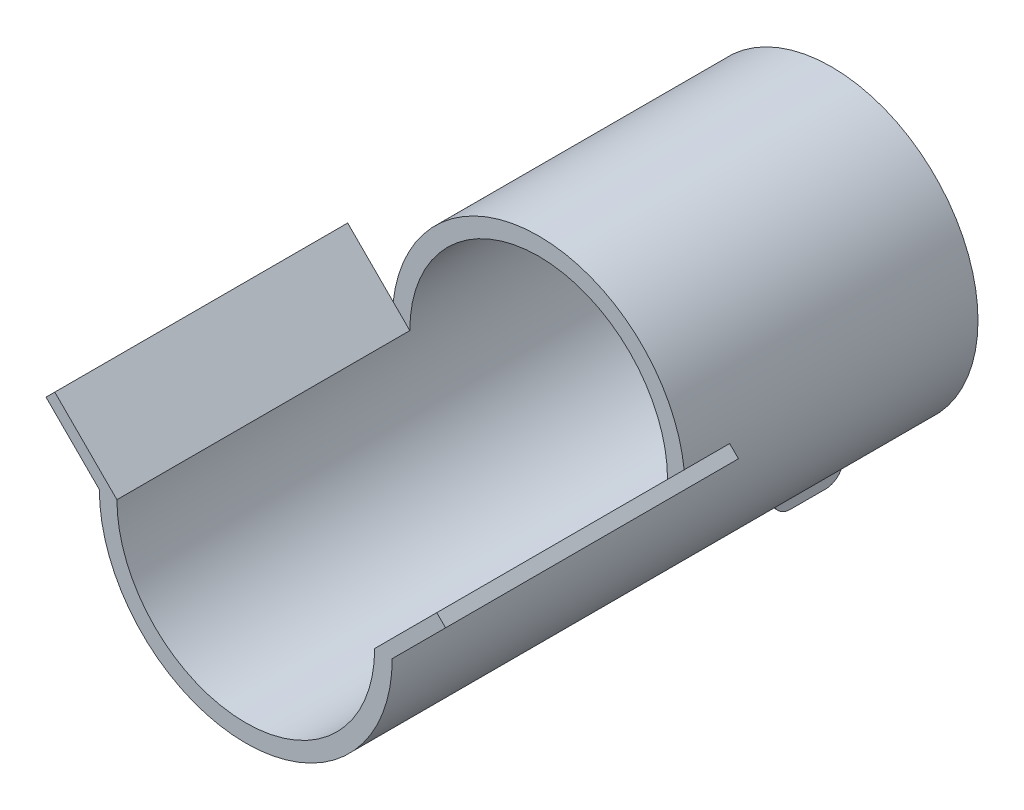
from build123d import *

# Parameters (mm, degrees)
SKETCH1_R           = 25
SKETCH1_R_2         = 22
BOSS_EXTRUDE1_DEPTH = 100
SKETCH2_W           = 10
SKETCH2_H           = 10
BOSS_EXTRUDE3_DEPTH = 3
FILLET2_R           = 3
FILLET3_R           = 3
SKETCH3_W           = 4
SKETCH3_H           = 10
BOSS_EXTRUDE4_DEPTH = 12
CUT_EXTRUDE1_REACH  = 111.309
SKETCH4_R           = 1.5
FILLET4_R           = 3
SKETCH5_W           = 63.273881994
SKETCH5_H           = 26.217893921
CUT_EXTRUDE2_DEPTH  = 50
BOSS_EXTRUDE5_DEPTH = 50


with BuildPart() as part:
    # Sketch1 → Boss-Extrude1 (new body)
    with BuildSketch(Plane.XY):
        Circle(SKETCH1_R)
        Circle(SKETCH1_R_2, mode=Mode.SUBTRACT)
    extrude(amount=BOSS_EXTRUDE1_DEPTH)

    # Sketch2 → Boss-Extrude3 (add)
    with BuildSketch(Plane(origin=(0, 0, 0), x_dir=(-1, 0, 0), z_dir=(0, 0, -1))):
        with Locations((0, 19.494897428)):
            Rectangle(SKETCH2_W, SKETCH2_H)
    extrude(amount=-BOSS_EXTRUDE3_DEPTH)

    # Fillet2
    # the kernel refuses this fillet: 3 mm, written as the material it adds along each edge
    with BuildSketch(Plane(origin=(0, 0, 3), x_dir=(-0.5397978604012739, 0.8417946720585768, 0), z_dir=(-0.8417946720585768, -0.5397978604012739, 0))) as fillet2_piece_1_section:
        with BuildLine():
            CenterArc((22 - FILLET2_R, -FILLET2_R), FILLET2_R, 0, 90)
            Line((22 - FILLET2_R, 0), (22, 0))
            Line((22, 0), (22, -FILLET2_R))
        make_face()
    fillet2_piece_1 = revolve(axis=Axis((0, 0, 3), (0, 0, -1)), revolution_arc=65.339758778, mode=Mode.PRIVATE)
    fillet2_piece_1 = split(fillet2_piece_1, bisect_by=Plane(origin=(5, 21.121644808, 3.678956026), z_dir=(-1, 0, 0)), keep=Keep.TOP, mode=Mode.PRIVATE)
    fillet2_piece_1 = split(fillet2_piece_1, bisect_by=Plane(origin=(-5, 21.121644808, 3.678956026), z_dir=(1, 0, 0)), keep=Keep.TOP, mode=Mode.PRIVATE)
    add(fillet2_piece_1)
    with BuildSketch(Plane(origin=(5, 21.424285286, 3), x_dir=(0.9454116384931546, -0.32587855683013084, 0), z_dir=(0, 0, -1))) as fillet2_piece_2:
        with BuildLine():
            CenterArc((4.201860731, 2.984203833), FILLET2_R, 160.981189421, 114.90106237)
            Line((1.365625815, 3.961839503), (0, 0))
            ThreePointArc((0, 0), (2.254656978, -0.11583856), (4.509313955, 0))
        make_face()
    extrude(amount=3)
    with BuildSketch(Plane(origin=(-5, 21.424285286, 3), x_dir=(-0.9454116384931545, -0.325878556830131, 0), z_dir=(0, 0, -1))) as fillet2_piece_3:
        with BuildLine():
            CenterArc((4.201860731, -2.984203833), FILLET2_R, 84.117748208, 114.90106237)
            Line((1.365625815, -3.961839503), (0, 0))
            ThreePointArc((0, 0), (2.254656978, 0.11583856), (4.509313955, 0))
        make_face()
    extrude(amount=3)
    with BuildSketch(Plane(origin=(0, 0, 3), x_dir=(-0.5397978604012739, 0.8417946720585768, 0), z_dir=(-0.8417946720585768, -0.5397978604012739, 0))) as fillet2_piece_4a_section:
        with BuildLine():
            CenterArc((22 - FILLET2_R, -FILLET2_R), FILLET2_R, 0, 90)
            Line((22 - FILLET2_R, 0), (22, 0))
            Line((22, 0), (22, -FILLET2_R))
        make_face()
    fillet2_piece_4a = revolve(axis=Axis((0, 0, 3), (0, 0, -1)), revolution_arc=65.339758778, mode=Mode.PRIVATE)
    fillet2_piece_4a = split(fillet2_piece_4a, bisect_by=Plane(origin=(-5, 19.550370475, 3.699165733), z_dir=(-1, 0, 0)), keep=Keep.TOP, mode=Mode.PRIVATE)
    with BuildSketch(Plane(origin=(-5, 21.424285286, 14.273284888), x_dir=(-0.9454116384931546, -0.3258785568301304, 0), z_dir=(0, 0, -1))) as fillet2_piece_4b_section:
        with BuildLine():
            CenterArc((4.201860731, -2.984203833), FILLET2_R, 84.117748208, 114.90106237)
            Line((1.365625815, -3.961839503), (0, 0))
            ThreePointArc((0, 0), (2.254656978, 0.11583856), (4.509313955, 0))
        make_face()
    fillet2_piece_4b = extrude(amount=14.273284888, mode=Mode.PRIVATE)
    fillet2_piece_4b = split(fillet2_piece_4b, bisect_by=Plane(origin=(-6.027024326, 20.156097629, 3), z_dir=(0, 0, 1)), keep=Keep.TOP, mode=Mode.PRIVATE)
    fillet2_piece_4 = fillet2_piece_4a & fillet2_piece_4b
    add(fillet2_piece_4)
    with BuildSketch(Plane(origin=(5, 21.424285286, 14.273284888), x_dir=(0.9454116384931546, -0.32587855683013073, 0), z_dir=(0, 0, -1))) as fillet2_piece_5a_section:
        with BuildLine():
            CenterArc((4.201860731, 2.984203833), FILLET2_R, 160.981189421, 114.90106237)
            Line((1.365625815, 3.961839503), (0, 0))
            ThreePointArc((0, 0), (2.254656978, -0.11583856), (4.509313955, 0))
        make_face()
    fillet2_piece_5a = extrude(amount=14.273284888, mode=Mode.PRIVATE)
    fillet2_piece_5a = split(fillet2_piece_5a, bisect_by=Plane(origin=(6.027024326, 20.156097629, 3), z_dir=(0, 0, 1)), keep=Keep.TOP, mode=Mode.PRIVATE)
    with BuildSketch(Plane(origin=(0, 0, 3), x_dir=(-0.5397978604012739, 0.8417946720585768, 0), z_dir=(-0.8417946720585768, -0.5397978604012739, 0))) as fillet2_piece_5b_section:
        with BuildLine():
            CenterArc((22 - FILLET2_R, -FILLET2_R), FILLET2_R, 0, 90)
            Line((22 - FILLET2_R, 0), (22, 0))
            Line((22, 0), (22, -FILLET2_R))
        make_face()
    fillet2_piece_5b = revolve(axis=Axis((0, 0, 3), (0, 0, -1)), revolution_arc=65.339758778, mode=Mode.PRIVATE)
    fillet2_piece_5b = split(fillet2_piece_5b, bisect_by=Plane(origin=(5, 19.550370668, 3.699165846), z_dir=(1, 0, 0)), keep=Keep.TOP, mode=Mode.PRIVATE)
    fillet2_piece_5 = fillet2_piece_5a & fillet2_piece_5b
    add(fillet2_piece_5)

    # Fillet3
    fillet3_edges = [part.edges().sort_by_distance(p)[0] for p in [
        (-5, 14.494897428, 1.5),
        (5, 14.494897428, 1.5),
    ]]
    fillet(fillet3_edges, radius=FILLET3_R)

    # Sketch3 → Boss-Extrude4 (add)
    with BuildSketch(Plane(origin=(0, 0, 0), x_dir=(-1, 0, 0), z_dir=(0, 0, -1))):
        with Locations((0, -29.919871589)):
            Rectangle(SKETCH3_W, SKETCH3_H)
    extrude(amount=-BOSS_EXTRUDE4_DEPTH)

    # Sketch4 → Cut-Extrude1 (cut, up to next)
    with BuildSketch(Plane.ZY.offset(2), mode=Mode.PRIVATE) as cut_extrude1_sk1:
        with Locations(Location((5, -30.919871589, 0), (0, 0, 270))):
            Circle(SKETCH4_R)
    cut_extrude1_tool1 = extrude(cut_extrude1_sk1.sketch, amount=-CUT_EXTRUDE1_REACH, mode=Mode.PRIVATE) & part.part
    add(cut_extrude1_tool1.solids().sort_by_distance((-2, -30.919872, 5))[0], mode=Mode.SUBTRACT)

    # Fillet4
    fillet4_edges = [part.edges().sort_by_distance(p)[0] for p in [
        (0, -25, 12),
        (-2, -24.919871589, 6),
        (0, -34.919871589, 12),
        (2, -24.919871589, 6),
        (0, -34.919871589, 0),
    ]]
    fillet(fillet4_edges, radius=FILLET4_R)

    # Sketch5 → Cut-Extrude2 (cut)
    with BuildSketch(Plane.XY.offset(100)):
        with Locations((0, 13.108946961)):
            Rectangle(SKETCH5_W, SKETCH5_H)
    extrude(amount=-CUT_EXTRUDE2_DEPTH, mode=Mode.SUBTRACT)

    # Sketch8 → Boss-Extrude5 (add)
    with BuildSketch(Plane.XY.offset(100)):
        Polygon((25, 0), (22, 0), (32.606601718, 10.606601718), (34.106601718, 9.106601718), align=None)
        Polygon((-25, 0), (-22, 0), (-32.606601718, 10.606601718), (-34.106601718, 9.106601718), align=None)
    extrude(amount=-BOSS_EXTRUDE5_DEPTH)


solid = part.part
